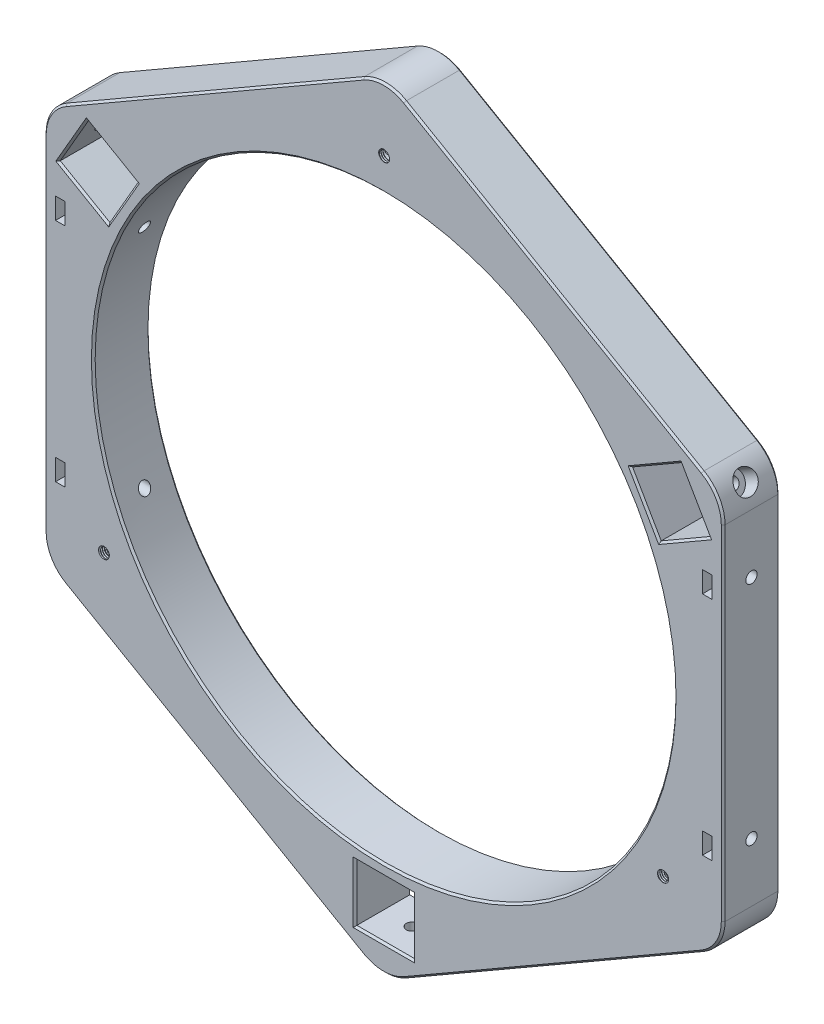
from build123d import *

# Parameters (mm, degrees)
SKETCH1_R           = 77
BOSS_EXTRUDE1_DEPTH = 15
SKETCH2_W           = 15.2
SKETCH2_H           = 15.2
CUT_EXTRUDE1_DEPTH  = 139.293166859
FILLET1_R           = 11.11
SKETCH9_R           = 1.5
CUT_EXTRUDE6_DEPTH  = 3
SKETCH10_R          = 3
CUT_EXTRUDE7_DEPTH  = 232.858348877
CIRPATTERN2_COUNT   = 3
SKETCH11_R          = 1.55
CUT_EXTRUDE8_DEPTH  = 10
SWEEP1_PITCH        = 0.5
SWEEP1_FROM         = 0
CIRPATTERN3_COUNT   = 3
SKETCH13_R          = 1.5
CUT_EXTRUDE9_DEPTH  = 208.534874679
SKETCH16_W          = 2.5
SKETCH16_H          = 5.6
CUT_EXTRUDE10_DEPTH = 138.00629252
CHAMFER3_SIZE       = 0.5


with BuildPart() as part:
    # Sketch1 → Boss-Extrude1 (new body)
    with BuildSketch(Plane.XY):
        Polygon((0, 103.923048454), (90, 51.961524227), (90, -51.961524227), (0, -103.923048454), (-90, -51.961524227), (-90, 51.961524227), align=None)
        Circle(SKETCH1_R, mode=Mode.SUBTRACT)
    extrude(amount=BOSS_EXTRUDE1_DEPTH)

    # Sketch2 → Cut-Extrude1 (cut, through all)
    with BuildSketch(Plane.XY.offset(15)):
        with Locations((0, -87.6)):
            Rectangle(SKETCH2_W, SKETCH2_H)
        Polygon((-65.482032303, 46.581793069), (-73.082032303, 33.418206931), (-86.24561844, 41.018206931), (-78.64561844, 54.181793069), align=None)
        Polygon((73.082032303, 33.418206931), (65.482032303, 46.581793069), (78.64561844, 54.181793069), (86.24561844, 41.018206931), align=None)
    extrude(amount=-CUT_EXTRUDE1_DEPTH, mode=Mode.SUBTRACT)

    # Fillet1
    fillet1_edges = [part.edges().sort_by_distance(p)[0] for p in [
        (0, -103.923048454, 7.5),
        (-90, -51.961524227, 7.5),
        (-90, 51.961524227, 7.5),
        (0, 103.923048454, 7.5),
        (90, 51.961524227, 7.5),
        (90, -51.961524227, 7.5),
    ]]
    fillet(fillet1_edges, radius=FILLET1_R)

    # Sketch9 → Cut-Extrude6 (cut)
    with BuildSketch(Plane(origin=(-82.44561844, 47.6, 0), x_dir=(0, 0, -1), z_dir=(0.866025403784436, -0.5000000000000046, 0))):
        with Locations(Location((-7.5, 0, 0), (0, 0, 90))):
            Circle(SKETCH9_R)
    cut_extrude6 = extrude(amount=-CUT_EXTRUDE6_DEPTH, mode=Mode.SUBTRACT)

    # Sketch10 → Cut-Extrude7 (cut, through all)
    with BuildSketch(Plane(origin=(-85.043694652, 49.1, 0), x_dir=(0, 0, -1), z_dir=(0.866025403784436, -0.5000000000000046, 0))):
        with Locations(Location((-7.5, 0, 0), (0, 0, 90))):
            Circle(SKETCH10_R)
    cut_extrude7 = extrude(amount=-CUT_EXTRUDE7_DEPTH, mode=Mode.SUBTRACT)

    # CirPattern2: Cut-Extrude6, Cut-Extrude7 ×3 about axis
    cirpattern2_axis = Axis((0, 0, 0), (0, 0, 1))
    add([cut_extrude6.rotate(cirpattern2_axis, i * 360 / CIRPATTERN2_COUNT) for i in range(1, CIRPATTERN2_COUNT)], mode=Mode.SUBTRACT)
    add([cut_extrude7.rotate(cirpattern2_axis, i * 360 / CIRPATTERN2_COUNT) for i in range(1, CIRPATTERN2_COUNT)], mode=Mode.SUBTRACT)

    # Sketch11 → Cut-Extrude8 (cut)
    with BuildSketch(Plane.XY.offset(15)):
        with Locations((0, 85.5)):
            Circle(SKETCH11_R)
    cut_extrude8 = extrude(amount=-CUT_EXTRUDE8_DEPTH, mode=Mode.SUBTRACT)

    # Sweep1: arcs per turn and ends read off the stored shape
    # Sweep1: the profile of Sketch15 profile screwed along a right-hand helix through 21.666667 turns, 6 arcs to a turn; built about Z, then put on its axis
    sweep1_z = Axis((0, 0, 0), (0, 0, 1))
    sweep1_corners = [(1.5503, 0, -0.500173205), (1.5503, 0, -0.149826795), (1.246891109, 0, -0.325)]
    with BuildLine(mode=Mode.PRIVATE) as sweep1_profile:
        Line(sweep1_corners[0], sweep1_corners[1])
        Line(sweep1_corners[1], sweep1_corners[2])
        Line(sweep1_corners[2], sweep1_corners[0])
    sweep1_cap = Face(sweep1_profile.wire())
    sweep1_turn_angles = [0, 30, 60, 90, 120, 150, 180, 210, 240, 270, 300, 330, 360]
    sweep1_turn_weights = [1, 0.8660254037844387, 1, 0.8660254037844387, 1, 0.8660254037844387, 1, 0.8660254037844387, 1, 0.8660254037844387, 1, 0.8660254037844387, 1]
    sweep1_turn_rails = [Edge.make_bspline([Vector(p[0], p[1], 0).rotate(sweep1_z, sweep1_turn_angles[k]) / sweep1_turn_weights[k] + Vector(0, 0, p[2] + SWEEP1_PITCH * sweep1_turn_angles[k] / 360) for k in range(13)], [0, 0, 0, 1, 1, 2, 2, 3, 3, 4, 4, 5, 5, 6, 6, 6], 2, sweep1_turn_weights) for p in sweep1_corners]
    sweep1_turn_sides = [Face.make_surface_from_curves(sweep1_turn_rails[p[0]], sweep1_turn_rails[p[1]]) for p in [(0, 1), (1, 2), (2, 0)]]
    sweep1_last_angles = [7560, 7590, 7620, 7650, 7680, 7710, 7740, 7770, 7800]
    sweep1_last_weights = [1, 0.8660254037844387, 1, 0.8660254037844387, 1, 0.8660254037844387, 1, 0.8660254037844387, 1]
    sweep1_last_rails = [Edge.make_bspline([Vector(p[0], p[1], 0).rotate(sweep1_z, sweep1_last_angles[k]) / sweep1_last_weights[k] + Vector(0, 0, p[2] + SWEEP1_PITCH * sweep1_last_angles[k] / 360) for k in range(9)], [0, 0, 0, 1, 1, 2, 2, 3, 3, 4, 4, 4], 2, sweep1_last_weights) for p in sweep1_corners]
    sweep1_last_sides = [Face.make_surface_from_curves(sweep1_last_rails[p[0]], sweep1_last_rails[p[1]]) for p in [(0, 1), (1, 2), (2, 0)]]
    sweep1 = Plane(origin=(0, 85.5, 15), x_dir=(0, 1, 0), z_dir=(0, 0, -1)) * split(Solid(Shell([*[p.moved(Location((0, 0, SWEEP1_PITCH * i))) for i in range(21) for p in sweep1_turn_sides], *sweep1_last_sides, sweep1_cap, sweep1_cap.rotate(sweep1_z, 7800).moved(Location((0, 0, SWEEP1_PITCH * 7800 / 360)))])), bisect_by=Plane.XY.offset(SWEEP1_FROM), keep=Keep.TOP, mode=Mode.PRIVATE)
    add(sweep1)

    # CirPattern3: Cut-Extrude8, Sweep1 ×3 about axis
    cirpattern3_axis = Axis((0, 0, 15), (0, 0, -1))
    add([cut_extrude8.rotate(cirpattern3_axis, i * 360 / CIRPATTERN3_COUNT) for i in range(1, CIRPATTERN3_COUNT)], mode=Mode.SUBTRACT)
    add([sweep1.rotate(cirpattern3_axis, i * 360 / CIRPATTERN3_COUNT) for i in range(1, CIRPATTERN3_COUNT)])

    # Sketch13 → Cut-Extrude9 (cut, through all)
    with BuildSketch(Plane(origin=(90, 0, 0), x_dir=(0, 0, -1), z_dir=(1, 0, 0))):
        with Locations(Location((-7.5, 30, 0), (0, 0, 90))):
            Circle(SKETCH13_R)
        with Locations(Location((-7.5, -30, 0), (0, 0, 90))):
            Circle(SKETCH13_R)
    extrude(amount=-CUT_EXTRUDE9_DEPTH, mode=Mode.SUBTRACT)

    # Sketch16 → Cut-Extrude10 (cut, through all)
    with BuildSketch(Plane.XY.offset(15)):
        with Locations((-85.75, 30)):
            Rectangle(SKETCH16_W, SKETCH16_H)
        with Locations((-85.75, -30)):
            Rectangle(SKETCH16_W, SKETCH16_H)
        with Locations((85.75, -30)):
            Rectangle(SKETCH16_W, SKETCH16_H)
        with Locations((85.75, 30)):
            Rectangle(SKETCH16_W, SKETCH16_H)
    extrude(amount=-CUT_EXTRUDE10_DEPTH, mode=Mode.SUBTRACT)

    # Chamfer3
    chamfer3_edges = [part.edges().sort_by_distance(p)[0] for p in [
        (-77, 0, 0),
        (-77, 0, 15),
        (87, 30, 0),
        (84.5, 30, 0),
        (85.75, 32.8, 0),
        (85.75, 27.2, 0),
        (87, -30, 0),
        (84.5, -30, 0),
        (85.75, -32.8, 0),
        (85.75, -27.2, 0),
        (-87, -30, 0),
        (-84.5, -30, 0),
        (-85.75, -32.8, 0),
        (-85.75, -27.2, 0),
        (-87, 30, 0),
        (-84.5, 30, 0),
        (-85.75, 32.8, 0),
        (-85.75, 27.2, 0),
        (7.6, -87.6, 0),
        (0, -95.2, 0),
        (-7.6, -87.6, 0),
        (0, -80, 0),
        (7.6, -87.6, 15),
        (0, -80, 15),
        (-7.6, -87.6, 15),
        (0, -95.2, 15),
        (-79.663825372, 37.218206931, 0),
        (-82.44561844, 47.6, 0),
        (-72.063825372, 50.381793069, 0),
        (-69.282032303, 40, 0),
        (-79.663825372, 37.218206931, 15),
        (-69.282032303, 40, 15),
        (-72.063825372, 50.381793069, 15),
        (-82.44561844, 47.6, 15),
        (72.063825372, 50.381793069, 0),
        (82.44561844, 47.6, 0),
        (79.663825372, 37.218206931, 0),
        (69.282032303, 40, 0),
        (72.063825372, 50.381793069, 15),
        (69.282032303, 40, 15),
        (79.663825372, 37.218206931, 15),
        (82.44561844, 47.6, 15),
        (-45, -77.942286341, 0),
        (-45, -77.942286341, 15),
        (45, -77.942286341, 0),
        (-90, 0, 0),
        (-45, 77.942286341, 0),
        (45, 77.942286341, 0),
        (90, 0, 0),
        (0, -102.204325473, 0),
        (88.511542236, -51.102162736, 0),
        (88.511542236, 51.102162736, 0),
        (0, 102.204325473, 0),
        (-88.511542236, 51.102162736, 0),
        (-88.511542236, -51.102162736, 0),
        (-90, 0, 15),
        (45, -77.942286341, 15),
        (90, 0, 15),
        (45, 77.942286341, 15),
        (-45, 77.942286341, 15),
        (0, -102.204325473, 15),
        (88.511542236, -51.102162736, 15),
        (88.511542236, 51.102162736, 15),
        (0, 102.204325473, 15),
        (-88.511542236, 51.102162736, 15),
        (-88.511542236, -51.102162736, 15),
    ]]
    chamfer(chamfer3_edges, length=CHAMFER3_SIZE)


solid = part.part
